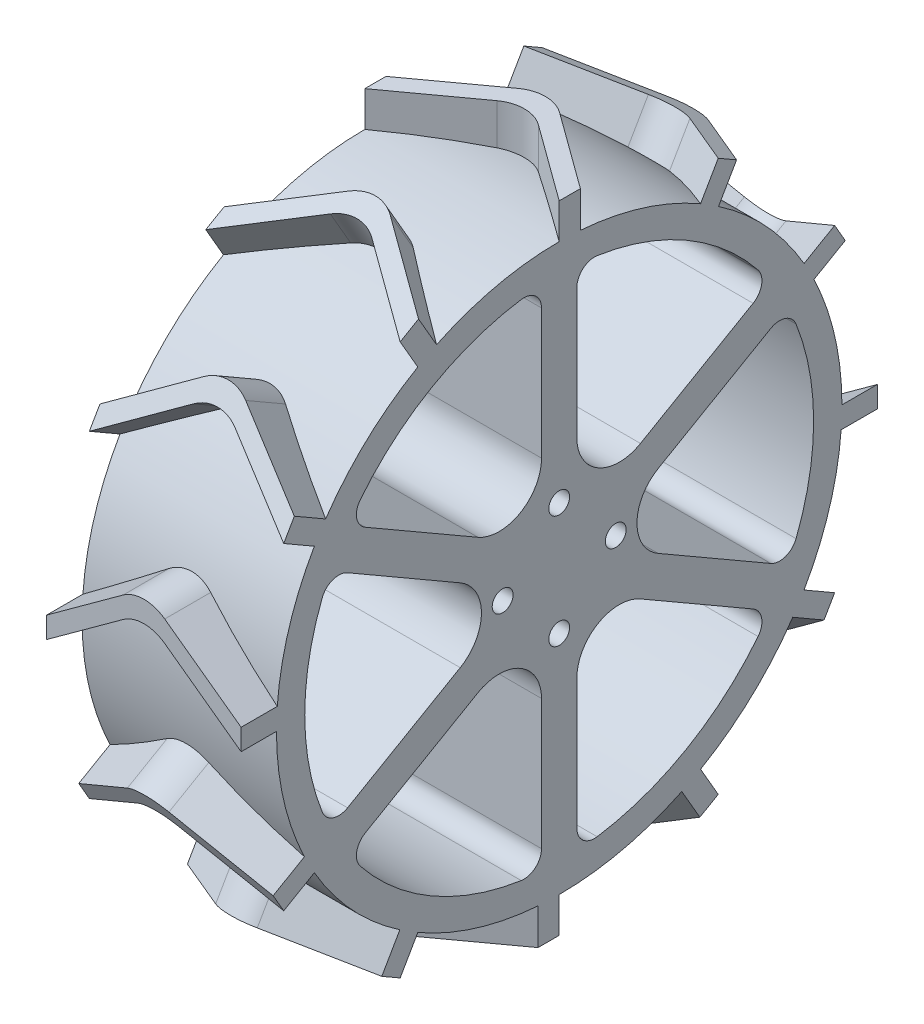
from build123d import *

# Parameters (mm, degrees)
SKETCH2_R                = 40
BOSS_EXTRUDE1_DEPTH      = 27.5
BOSS_EXTRUDE2_DEPTH      = 45
CIRPATTERN2_COUNT        = 12
CUT_EXTRUDE3_REACH       = 71.327
FILLET1_R                = 6
CIRPATTERN3_COUNT        = 6
FILLET1_OF_CIRPATTERN3_R = 6
CUT_EXTRUDE4_REACH       = 71.327
SKETCH6_R                = 1.4750000000000003
SKETCH6_R_2              = 1.475


with BuildPart() as part:
    # Sketch2 → Boss-Extrude1 (new body)
    with BuildSketch(Plane(origin=(0, 0, 0), x_dir=(0, 0, -1), z_dir=(1, 0, 0))):
        Circle(SKETCH2_R)
    extrude(amount=BOSS_EXTRUDE1_DEPTH)

    # Sketch4 → Boss-Extrude2 (add)
    with BuildSketch(Plane(origin=(0, 0, 0), x_dir=(1, 0, 0), z_dir=(0, 1, 0))):
        with BuildLine():
            Line((0, 0), (10.809141511624768, 7.861193826636196))
            ThreePointArc((10.809141511624768, 7.861193826636196), (13.75, 8.817513405120254), (16.69085848837523, 7.861193826636196))
            Line((16.69085848837523, 7.861193826636196), (27.5, 0))
            Line((27.5, 0), (27.5, 3))
            Line((27.5, 3), (16.69085848837523, 10.861193826636196))
            ThreePointArc((16.69085848837523, 10.861193826636196), (13.75, 11.817513405120252), (10.809141511624768, 10.861193826636196))
            Line((10.809141511624768, 10.861193826636196), (0, 3))
            Line((0, 3), (0, 0))
        make_face()
    boss_extrude2 = extrude(amount=BOSS_EXTRUDE2_DEPTH)

    # CirPattern2: Boss-Extrude2 ×12 about axis
    cirpattern2_axis = Axis((27.5, 0, 0), (-1, 0, 0))
    for i in range(1, CIRPATTERN2_COUNT):
        add(boss_extrude2.rotate(cirpattern2_axis, i * 360 / CIRPATTERN2_COUNT))

    # Sketch5 → Cut-Extrude3 (cut, up to next)
    with BuildSketch(Plane.ZY, mode=Mode.PRIVATE) as cut_extrude3_sk1:
        with BuildLine():
            Line((2.499999999999992, 33.12476415010377), (2.4999999999999987, 4.330127018922181))
            Line((2.4999999999999987, 4.330127018922181), (27.436887248357948, 18.727445584512928))
            ThreePointArc((27.436887248357948, 18.727445584512928), (28.6433531155643, 20.427992739848364), (28.141132565399595, 22.451651563673586))
            ThreePointArc((28.141132565399595, 22.451651563673586), (18.000000000000025, 31.176914536239778), (5.3731343283582, 35.59676147473838))
            ThreePointArc((5.3731343283582, 35.59676147473838), (3.3694841032506733, 35.019867817571004), (2.499999999999992, 33.12476415010377))
        make_face()
    cut_extrude3_tool1 = extrude(cut_extrude3_sk1.sketch, amount=-CUT_EXTRUDE3_REACH, mode=Mode.PRIVATE) & part.part
    cut_extrude3 = cut_extrude3_tool1.solids().sort_by_distance((0, 21.473973, 12.398004))[0]
    add(cut_extrude3, mode=Mode.SUBTRACT)

    # Fillet1
    fillet1_edges = [part.edges().sort_by_distance(p)[0] for p in [
        (13.75, 4.330127018922181, 2.4999999999999987),
    ]]
    fillet(fillet1_edges, radius=FILLET1_R)

    # CirPattern3: Cut-Extrude3 ×6 about axis
    cirpattern3_axis = Axis((0, 0, 0), (1, 0, 0))
    for i in range(1, CIRPATTERN3_COUNT):
        add(cut_extrude3.rotate(cirpattern3_axis, i * 360 / CIRPATTERN3_COUNT), mode=Mode.SUBTRACT)

    # Fillet1 of CirPattern3
    fillet1_of_cirpattern3_edges = [part.edges().sort_by_distance(p)[0] for p in [
        (13.75, -4.44e-15, 4.999999999999989),
        (13.75, -4.330127018922186, 2.499999999999991),
        (13.75, -4.330127018922181, -2.4999999999999982),
        (13.75, 2.22e-15, -4.999999999999989),
        (13.75, 4.3301270189221865, -2.49999999999999),
    ]]
    fillet(fillet1_of_cirpattern3_edges, radius=FILLET1_OF_CIRPATTERN3_R)

    # Sketch6 → Cut-Extrude4 (cut, up to next)
    with BuildSketch(Plane.ZY, mode=Mode.PRIVATE) as cut_extrude4_sk1:
        with Locations((0, 8)):
            Circle(SKETCH6_R)
    cut_extrude4_tool1 = extrude(cut_extrude4_sk1.sketch, amount=-CUT_EXTRUDE4_REACH, mode=Mode.PRIVATE) & part.part
    # Sketch6 → Cut-Extrude4 (cut, up to next)
    with BuildSketch(Plane.ZY, mode=Mode.PRIVATE) as cut_extrude4_sk2:
        with Locations((8, -2.793e-14)):
            Circle(SKETCH6_R_2)
    cut_extrude4_tool2 = extrude(cut_extrude4_sk2.sketch, amount=-CUT_EXTRUDE4_REACH, mode=Mode.PRIVATE) & part.part
    # Sketch6 → Cut-Extrude4 (cut, up to next)
    with BuildSketch(Plane.ZY, mode=Mode.PRIVATE) as cut_extrude4_sk3:
        with Locations((-5.586e-14, -8)):
            Circle(SKETCH6_R)
    cut_extrude4_tool3 = extrude(cut_extrude4_sk3.sketch, amount=-CUT_EXTRUDE4_REACH, mode=Mode.PRIVATE) & part.part
    # Sketch6 → Cut-Extrude4 (cut, up to next)
    with BuildSketch(Plane.ZY, mode=Mode.PRIVATE) as cut_extrude4_sk4:
        with Locations((-7.999999999999998, 8.38e-14)):
            Circle(SKETCH6_R_2)
    cut_extrude4_tool4 = extrude(cut_extrude4_sk4.sketch, amount=-CUT_EXTRUDE4_REACH, mode=Mode.PRIVATE) & part.part
    add(cut_extrude4_tool1.solids().sort_by_distance((0, 8, 0))[0], mode=Mode.SUBTRACT)
    add(cut_extrude4_tool2.solids().sort_by_distance((0, 0, 8))[0], mode=Mode.SUBTRACT)
    add(cut_extrude4_tool3.solids().sort_by_distance((0, -8, 0))[0], mode=Mode.SUBTRACT)
    add(cut_extrude4_tool4.solids().sort_by_distance((0, 0, -8))[0], mode=Mode.SUBTRACT)


solid = part.part
